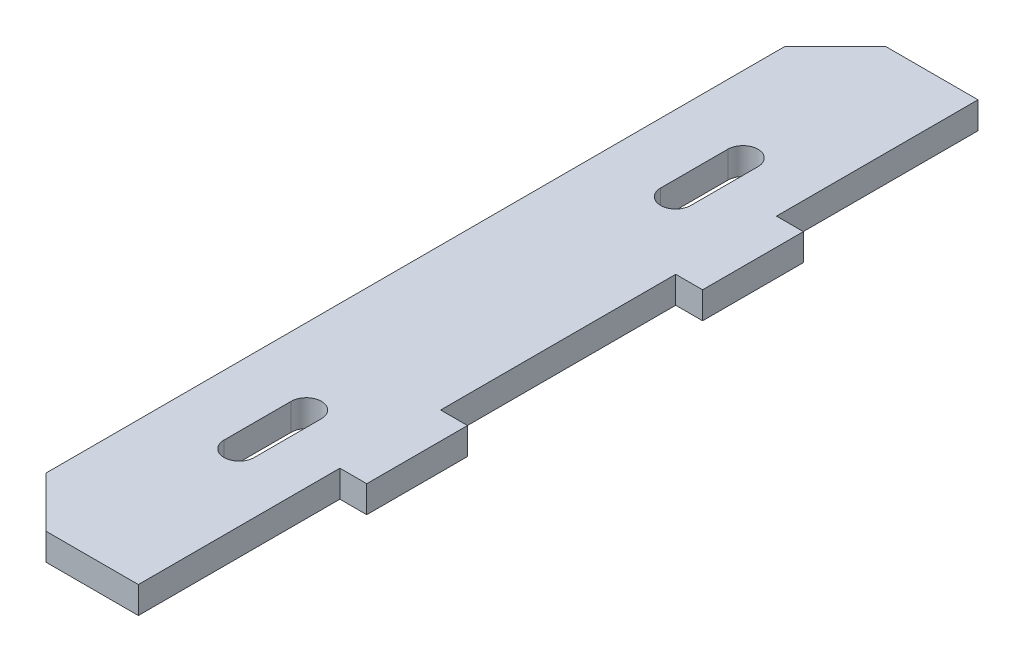
from build123d import *

# Parameters (mm, degrees)
SKETCH1_W           = 685
SKETCH1_H           = 250
BASE_FLANGE1_DEPTH  = 8
SKETCH6_W           = 60
SKETCH6_H           = 8
SKETCH6_W_2         = 70
EXTRUDE1_DEPTH      = 8
SKETCH7_W           = 250
SKETCH7_H           = 73.5
BASE_FLANGE2_DEPTH  = 8
SKETCH12_W          = 30.5
SKETCH12_H          = 8.5
EXTRUDE2_DEPTH      = 699.681794525
SKETCH14_W          = 250
SKETCH14_H          = 8
BASE_FLANGE3_DEPTH  = 50.5
SKETCH19_W          = 60
SKETCH19_H          = 8
SKETCH19_W_2        = 70
EXTRUDE3_DEPTH      = 8
BREAK_CORNER1_START = 41.5
BREAK_CORNER1_DEPTH = 8
EXTRUDE4_DEPTH      = 8
BASE_FLANGE4_DEPTH  = 8
SKETCH38_W          = 8.5
SKETCH38_H          = 20.5
EXTRUDE5_DEPTH      = 10
SKETCH39_W          = 20.5
SKETCH39_H          = 8.5
EXTRUDE6_DEPTH      = 10


# Read off the part's stored shape, not the designer's step: Break-Corner1
# Sheet-metal steps are written as plain solids
with BuildPart() as part:
    # Sketch1 → Base-Flange1 (new body)
    with BuildSketch(Plane(origin=(0, 0, 0), x_dir=(1, 0, 0), z_dir=(0, 1, 0))):
        Rectangle(SKETCH1_W, SKETCH1_H)
    extrude(amount=-BASE_FLANGE1_DEPTH)

    # Sketch6 → Extrude1 (cut)
    with BuildSketch(Plane(origin=(342.5, 0, 0), x_dir=(0, 0, -1), z_dir=(1, 0, 0))):
        with Locations((-95, -4)):
            Rectangle(SKETCH6_W, SKETCH6_H)
        with Locations((95, -4)):
            Rectangle(SKETCH6_W, SKETCH6_H)
        with Locations((0, -4)):
            Rectangle(SKETCH6_W_2, SKETCH6_H)
    extrude1 = extrude(amount=-EXTRUDE1_DEPTH, mode=Mode.SUBTRACT)

    # Mirror1: Extrude1 across plane
    add(extrude1.mirror(Plane(origin=(0, 0, 0), x_dir=(0, 0, 1), z_dir=(1, 0, 0))), mode=Mode.SUBTRACT)

    # Sketch39 → Extrude6 (cut)
    with BuildSketch(Plane.XZ.offset(8)):
        with Locations((289.5, 0)):
            Rectangle(SKETCH39_W, SKETCH39_H)
        with Locations((229.5, 0)):
            Rectangle(SKETCH39_W, SKETCH39_H)
        with Locations((-289.5, 0)):
            Rectangle(SKETCH39_W, SKETCH39_H)
        with Locations((-229.5, 0)):
            Rectangle(SKETCH39_W, SKETCH39_H)
    extrude(amount=-EXTRUDE6_DEPTH, mode=Mode.SUBTRACT)


with BuildPart() as body_2:
    # Sketch7 → Base-Flange2 (new body)
    with BuildSketch(Plane(origin=(334.5, 0, 0), x_dir=(0, 0, -1), z_dir=(1, 0, 0))):
        with Locations((0, 20.75)):
            Rectangle(SKETCH7_W, SKETCH7_H)
    extrude(amount=BASE_FLANGE2_DEPTH)

    # Sketch12 → Extrude2 (cut, through all)
    with BuildSketch(Plane(origin=(342.5, 0, 0), x_dir=(0, 0, -1), z_dir=(1, 0, 0))):
        with Locations((-50, -4)):
            Rectangle(SKETCH12_W, SKETCH12_H)
        with Locations((50, -4)):
            Rectangle(SKETCH12_W, SKETCH12_H)
        with Locations((50, 45.5)):
            Rectangle(SKETCH12_W, SKETCH12_H)
        with Locations((-50, 45.5)):
            Rectangle(SKETCH12_W, SKETCH12_H)
    extrude(amount=-EXTRUDE2_DEPTH, mode=Mode.SUBTRACT)

    # Sketch38 → Extrude5 (cut)
    with BuildSketch(Plane(origin=(342.5, 0, 0), x_dir=(0, 0, -1), z_dir=(1, 0, 0))):
        with Locations((0, 27.5)):
            Rectangle(SKETCH38_W, SKETCH38_H)
    extrude(amount=-EXTRUDE5_DEPTH, mode=Mode.SUBTRACT)


with BuildPart() as body_3:
    # Sketch14 → Base-Flange3 (new body)
    with BuildSketch(Plane.ZY.offset(-334.5)):
        with Locations((0, 45.5)):
            Rectangle(SKETCH14_W, SKETCH14_H)
    extrude(amount=-BASE_FLANGE3_DEPTH)

    # Sketch19 → Extrude3 (cut)
    with BuildSketch(Plane(origin=(342.5, 0, 0), x_dir=(0, 0, -1), z_dir=(1, 0, 0))):
        with Locations((95, 45.5)):
            Rectangle(SKETCH19_W, SKETCH19_H)
        with Locations((0, 45.5)):
            Rectangle(SKETCH19_W_2, SKETCH19_H)
        with Locations((-95, 45.5)):
            Rectangle(SKETCH19_W, SKETCH19_H)
    extrude(amount=-EXTRUDE3_DEPTH, mode=Mode.SUBTRACT)

    # Break-Corner1 outline → Break-Corner1 (cut)
    with BuildSketch(Plane(origin=(0, 0, 0), x_dir=(1, 0, 0), z_dir=(0, 1, 0)).offset(BREAK_CORNER1_START)):
        Polygon((385, -125), (385, -110), (370, -125), align=None)
        Polygon((370, 125), (385, 110), (385, 125), align=None)
    extrude(amount=BREAK_CORNER1_DEPTH, mode=Mode.SUBTRACT)

    # Sketch20 → Extrude4 (cut)
    with BuildSketch(Plane(origin=(0, 49.5, 0), x_dir=(1, 0, 0), z_dir=(0, 1, 0))):
        with BuildLine():
            Line((367, 75), (367, 55))
            ThreePointArc((367, 55), (362.5, 50.5), (358, 55))
            Line((358, 55), (358, 75))
            ThreePointArc((358, 75), (362.5, 79.5), (367, 75))
        make_face()
        with BuildLine():
            Line((367, -75), (367, -55))
            ThreePointArc((367, -55), (362.5, -50.5), (358, -55))
            Line((358, -55), (358, -75))
            ThreePointArc((358, -75), (362.5, -79.5), (367, -75))
        make_face()
    extrude(amount=-EXTRUDE4_DEPTH, mode=Mode.SUBTRACT)


with BuildPart() as body_4:
    # Mirror4: mirrored copy
    add(body_3.part.mirror(Plane(origin=(0, 0, 0), x_dir=(0, 0, 1), z_dir=(1, 0, 0))))


with BuildPart() as body_5:
    # Sketch29 → Base-Flange4 (new body)
    with BuildSketch(Plane.XY.offset(4)):
        Polygon((219.5, 0), (219.5, -8), (239.5, -8), (239.5, 0), (279.5, 0), (279.5, -8), (299.5, -8), (299.5, 0), (334.5, 0), (334.5, 17.5), (342.5, 17.5), (342.5, 37.5), (334.5, 37.5), (334.5, 57.5), (194.5, 10), (194.5, 0), align=None)
    extrude(amount=-BASE_FLANGE4_DEPTH)


with BuildPart() as body_6:
    # Mirror5: mirrored copy
    add(body_5.part.mirror(Plane(origin=(0, 0, 0), x_dir=(0, 0, 1), z_dir=(1, 0, 0))))


with BuildPart() as body_7:
    # Mirror3: mirrored copy
    add(body_2.part.mirror(Plane(origin=(0, 0, 0), x_dir=(0, 0, 1), z_dir=(1, 0, 0))))


solid = body_4.part
